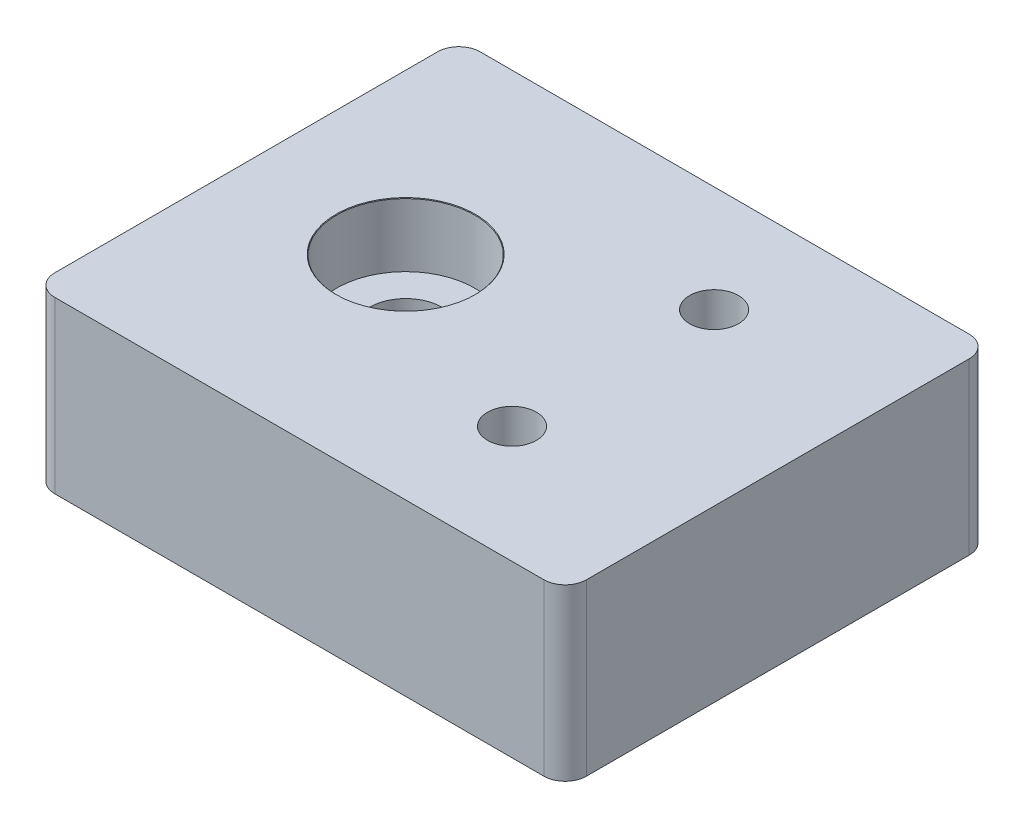
from build123d import *

# Parameters (mm, degrees)
SKETCH1_W           = 25
SKETCH1_H           = 20
BOSS_EXTRUDE1_DEPTH = 8
FILLET1_R           = 1
SKETCH5_R           = 1.15
CUT_EXTRUDE1_DEPTH  = 5


with BuildPart() as part:
    # Sketch1 → Boss-Extrude1 (new body)
    with BuildSketch(Plane(origin=(0, 0, 0), x_dir=(1, 0, 0), z_dir=(0, 1, 0))):
        Rectangle(SKETCH1_W, SKETCH1_H)
    extrude(amount=BOSS_EXTRUDE1_DEPTH)

    # Sketch4 → CBORE for M3 SHCS1 (revolve, cut)
    with BuildSketch(Plane(origin=(-5, 8, 0), x_dir=(0, 0, 1), z_dir=(1, 0, 0))):
        Polygon((0, 0), (0, 8), (1.7, 8), (1.7, 3), (3.25, 3), (3.25, 0.025), (3.275, 0), align=None)
    revolve(axis=Axis((-5, 14.35, 0), (0, -1, 0)), mode=Mode.SUBTRACT)

    # Fillet1
    fillet1_edges = [part.edges().sort_by_distance(p)[0] for p in [
        (12.5, 4, 10),
        (-12.5, 4, 10),
        (12.5, 4, -10),
        (-12.5, 4, -10),
    ]]
    fillet(fillet1_edges, radius=FILLET1_R)

    # Sketch5 → Cut-Extrude1 (cut)
    with BuildSketch(Plane(origin=(0, 8, 0), x_dir=(1, 0, 0), z_dir=(0, 1, 0))):
        with Locations((4.5, 5)):
            Circle(SKETCH5_R)
        with Locations((4.5, -4.5)):
            Circle(SKETCH5_R)
    extrude(amount=-CUT_EXTRUDE1_DEPTH, mode=Mode.SUBTRACT)


solid = part.part
